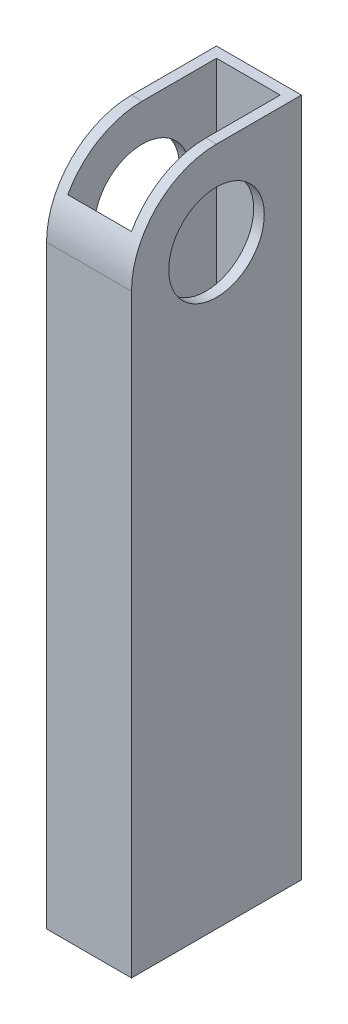
from build123d import *

# Parameters (mm, degrees)
SKETCH1_W           = 25.4
SKETCH1_H           = 50.8
SKETCH1_W_2         = 19.05
SKETCH1_H_2         = 44.45
EXTRUDE_THIN1_DEPTH = 203.2
SKETCH2_R           = 14.2875
CUT_EXTRUDE1_DEPTH  = 207.350575478
CUT_EXTRUDE3_DEPTH  = 207.350575478


with BuildPart() as part:
    # Sketch1 → Extrude-Thin1 (new body)
    with BuildSketch(Plane(origin=(0, 0, 0), x_dir=(1, 0, 0), z_dir=(0, 1, 0))):
        Rectangle(SKETCH1_W, SKETCH1_H)
        Rectangle(SKETCH1_W_2, SKETCH1_H_2, mode=Mode.SUBTRACT)
    extrude(amount=EXTRUDE_THIN1_DEPTH)

    # Sketch2 → Cut-Extrude1 (cut, through all)
    with BuildSketch(Plane(origin=(12.7, 0, 0), x_dir=(0, 0, -1), z_dir=(1, 0, 0))):
        with Locations((0, 177.8)):
            Circle(SKETCH2_R)
    extrude(amount=-CUT_EXTRUDE1_DEPTH, mode=Mode.SUBTRACT)

    # Sketch4 → Cut-Extrude3 (cut, through all)
    with BuildSketch(Plane(origin=(12.7, 0, 0), x_dir=(0, 0, -1), z_dir=(1, 0, 0))):
        with BuildLine():
            Line((-25.4, 203.2), (0, 203.2))
            ThreePointArc((0, 203.2), (-17.960512242, 195.760512242), (-25.4, 177.8))
            Line((-25.4, 177.8), (-25.4, 190.5))
            Line((-25.4, 190.5), (-25.4, 203.2))
        make_face()
    extrude(amount=-CUT_EXTRUDE3_DEPTH, mode=Mode.SUBTRACT)


solid = part.part
